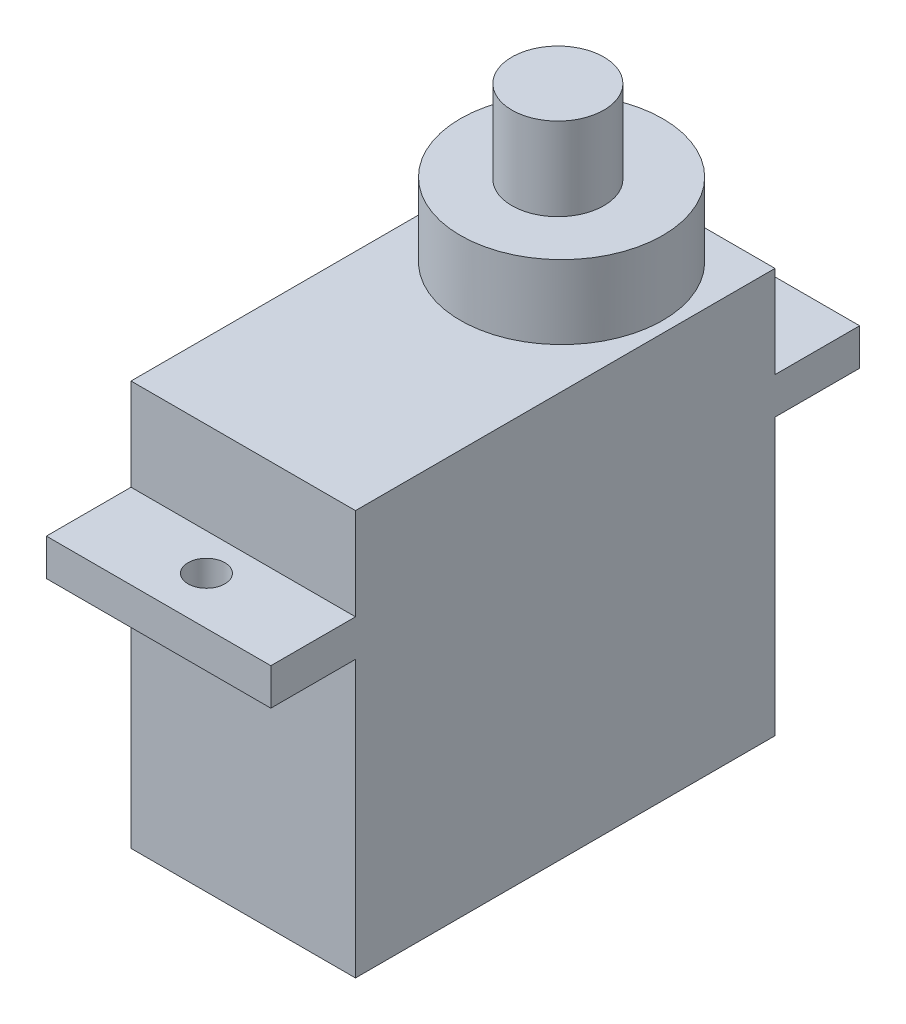
from build123d import *

# Parameters (mm, degrees)
SKETCH2_W           = 12.2
SKETCH2_H           = 22.8
BOSS_EXTRUDE1_DEPTH = 22
SKETCH3_W           = 12.2
SKETCH3_H           = 4.6
SKETCH3_R           = 1
BOSS_EXTRUDE2_DEPTH = 2
SKETCH4_R           = 5.5
BOSS_EXTRUDE3_DEPTH = 4
SKETCH5_R           = 2.5
BOSS_EXTRUDE4_DEPTH = 4.5


with BuildPart() as part:
    # Sketch2 → Boss-Extrude1 (new body)
    with BuildSketch(Plane(origin=(0, 0, 0), x_dir=(1, 0, 0), z_dir=(0, 1, 0))):
        Rectangle(SKETCH2_W, SKETCH2_H)
    extrude(amount=BOSS_EXTRUDE1_DEPTH)

    # Sketch3 → Boss-Extrude2 (add)
    # profile 1 of 2: a face of its own
    with BuildSketch(Plane(origin=(0, 15, 0), x_dir=(1, 0, 0), z_dir=(0, 1, 0))):
        with Locations((0, 13.7)):
            Rectangle(SKETCH3_W, SKETCH3_H)
        with Locations((0, 13.4)):
            Circle(SKETCH3_R, mode=Mode.SUBTRACT)
    # profile 2 of 2: a face of its own
    with BuildSketch(Plane(origin=(0, 15, 0), x_dir=(1, 0, 0), z_dir=(0, 1, 0))):
        with Locations((0, -13.7)):
            Rectangle(SKETCH3_W, SKETCH3_H)
        with Locations((0, -13.4)):
            Circle(SKETCH3_R, mode=Mode.SUBTRACT)
    extrude(amount=BOSS_EXTRUDE2_DEPTH)

    # Sketch4 → Boss-Extrude3 (add)
    with BuildSketch(Plane(origin=(0, 22, 0), x_dir=(1, 0, 0), z_dir=(0, 1, 0))):
        with Locations((0, 5.9)):
            Circle(SKETCH4_R)
    extrude(amount=BOSS_EXTRUDE3_DEPTH)

    # Sketch5 → Boss-Extrude4 (add)
    with BuildSketch(Plane(origin=(0, 26, 0), x_dir=(1, 0, 0), z_dir=(0, 1, 0))):
        with Locations((0, 5.7)):
            Circle(SKETCH5_R)
    extrude(amount=BOSS_EXTRUDE4_DEPTH)


solid = part.part
